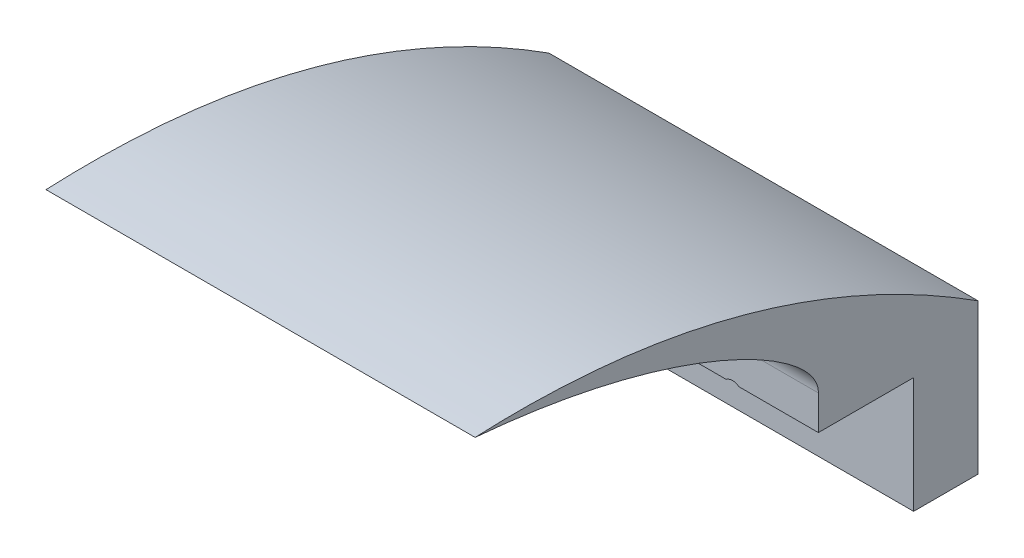
from build123d import *

# Parameters (mm, degrees)
BOSS_EXTRUDE1_DEPTH     = 63.5
CUT_EXTRUDE1_DEPTH      = 168.419011538
CUT_EXTRUDE1_DEPTH_BACK = 168.419011538
SKETCH2_R               = 3.175


with BuildPart() as part:
    # Sketch1 → Boss-Extrude1 (new, symmetric)
    with BuildSketch(Plane(origin=(0, 0, 0), x_dir=(0, 0, -1), z_dir=(1, 0, 0))):
        with BuildLine():
            Line((0.809260665, 1.527522938), (0.809260665, -8.632477062))
            Line((0.809260665, -8.632477062), (29.003260665, -8.632477062))
            Line((29.003260665, -8.632477062), (29.003260665, -42.922477062))
            Line((29.003260665, -42.922477062), (48.053260665, -42.922477062))
            Line((48.053260665, -42.922477062), (48.053260665, 1.527522938))
            add(Edge.make_bspline(
                [(-100.790739335, 40.936245598), (-19.432334381, 44.723152192), (48.053260665, 1.527522938)],
                knots=[0, 0, 0, 1, 1, 1], degree=2))
            add(Edge.make_bspline(
                [(-100.790739335, 40.936245598), (-95.812000817, 40.506536715), (-85.404095735, 39.35609048), (-70.04704926, 36.825372047), (-55.204457945, 33.455234316), (-41.848670928, 29.540032245), (-30.135862863, 25.255462099), (-20.192126341, 20.775035432), (-12.11168478, 16.271531389), (-5.930472237, 11.904209881), (-1.681652897, 7.768063044), (0.491896357, 4.287160304), (0.81175974, 2.163002008), (0.809260665, 1.527522938)],
                knots=[0.35379081, 0.35379081, 0.35379081, 0.35379081, 0.374279703, 0.396711254, 0.417576734, 0.436654006, 0.45374439, 0.468679994, 0.481329415, 0.491630702, 0.499615789, 0.505546281, 0.508115399, 0.508115399, 0.508115399, 0.508115399], degree=3))
        make_face()
    extrude(amount=BOSS_EXTRUDE1_DEPTH, both=True)

    # Sketch2 → Cut-Extrude1 (cut, two sides: drawn at the far end of the back side and taken through both)
    with BuildSketch(Plane(origin=(0, 0, -48.053260665), x_dir=(-1, 0, 0), z_dir=(0, 0, -1)).offset(-CUT_EXTRUDE1_DEPTH_BACK)):
        with Locations((-38.1, -11.172477062)):
            Circle(SKETCH2_R)
        with Locations((38.1, -11.172477062)):
            Circle(SKETCH2_R)
    extrude(amount=CUT_EXTRUDE1_DEPTH + CUT_EXTRUDE1_DEPTH_BACK, mode=Mode.SUBTRACT)


solid = part.part
